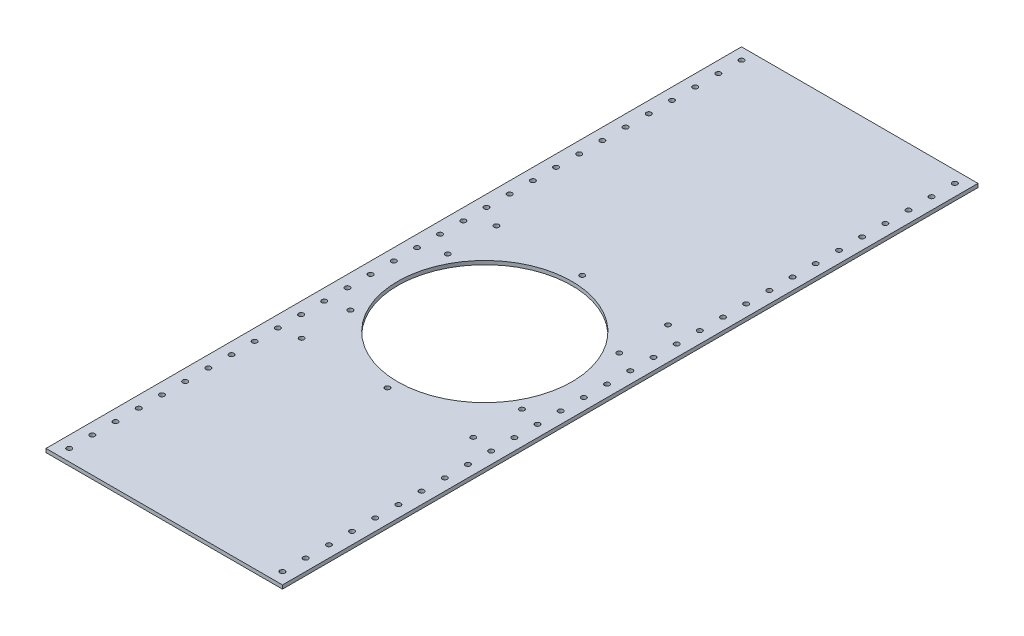
from build123d import *

# Parameters (mm, degrees)
SKETCH1_W           = 204
SKETCH1_H           = 600
SKETCH1_R           = 2.15
SKETCH1_R_2         = 2.125
SKETCH1_R_3         = 75.125
BOSS_EXTRUDE1_DEPTH = 3.175


with BuildPart() as part:
    # Sketch1 → Boss-Extrude1 (new body)
    with BuildSketch(Plane(origin=(0, 0, 0), x_dir=(1, 0, 0), z_dir=(0, 1, 0))):
        with Locations((0, -50)):
            Rectangle(SKETCH1_W, SKETCH1_H)
        with Locations((92, 240)):
            Circle(SKETCH1_R, mode=Mode.SUBTRACT)
        with Locations((92, 220)):
            Circle(SKETCH1_R, mode=Mode.SUBTRACT)
        with Locations((92, 200)):
            Circle(SKETCH1_R, mode=Mode.SUBTRACT)
        with Locations((92, 180)):
            Circle(SKETCH1_R, mode=Mode.SUBTRACT)
        with Locations((92, 160)):
            Circle(SKETCH1_R, mode=Mode.SUBTRACT)
        with Locations((92, 140)):
            Circle(SKETCH1_R, mode=Mode.SUBTRACT)
        with Locations((92, 120)):
            Circle(SKETCH1_R, mode=Mode.SUBTRACT)
        with Locations((92, 100)):
            Circle(SKETCH1_R, mode=Mode.SUBTRACT)
        with Locations((92, 80)):
            Circle(SKETCH1_R, mode=Mode.SUBTRACT)
        with Locations((92, 60)):
            Circle(SKETCH1_R, mode=Mode.SUBTRACT)
        with Locations((92, 40)):
            Circle(SKETCH1_R, mode=Mode.SUBTRACT)
        with Locations((92, 20)):
            Circle(SKETCH1_R, mode=Mode.SUBTRACT)
        with Locations((92, 0)):
            Circle(SKETCH1_R, mode=Mode.SUBTRACT)
        with Locations((92, -20)):
            Circle(SKETCH1_R, mode=Mode.SUBTRACT)
        with Locations((92, -40)):
            Circle(SKETCH1_R, mode=Mode.SUBTRACT)
        with Locations((92, -60)):
            Circle(SKETCH1_R, mode=Mode.SUBTRACT)
        with Locations((92, -80)):
            Circle(SKETCH1_R, mode=Mode.SUBTRACT)
        with Locations((92, -100)):
            Circle(SKETCH1_R, mode=Mode.SUBTRACT)
        with Locations((92, -120)):
            Circle(SKETCH1_R, mode=Mode.SUBTRACT)
        with Locations((92, -140)):
            Circle(SKETCH1_R, mode=Mode.SUBTRACT)
        with Locations((92, -160)):
            Circle(SKETCH1_R, mode=Mode.SUBTRACT)
        with Locations((92, -180)):
            Circle(SKETCH1_R, mode=Mode.SUBTRACT)
        with Locations((92, -200)):
            Circle(SKETCH1_R, mode=Mode.SUBTRACT)
        with Locations((92, -220)):
            Circle(SKETCH1_R, mode=Mode.SUBTRACT)
        with Locations((92, -240)):
            Circle(SKETCH1_R, mode=Mode.SUBTRACT)
        with Locations((92, -260)):
            Circle(SKETCH1_R, mode=Mode.SUBTRACT)
        with Locations((92, -280)):
            Circle(SKETCH1_R, mode=Mode.SUBTRACT)
        with Locations((92, -300)):
            Circle(SKETCH1_R, mode=Mode.SUBTRACT)
        with Locations((92, -320)):
            Circle(SKETCH1_R, mode=Mode.SUBTRACT)
        with Locations((92, -340)):
            Circle(SKETCH1_R, mode=Mode.SUBTRACT)
        with Locations((-92, -340)):
            Circle(SKETCH1_R, mode=Mode.SUBTRACT)
        with Locations((-92, -320)):
            Circle(SKETCH1_R, mode=Mode.SUBTRACT)
        with Locations((-92, -300)):
            Circle(SKETCH1_R, mode=Mode.SUBTRACT)
        with Locations((-92, -280)):
            Circle(SKETCH1_R, mode=Mode.SUBTRACT)
        with Locations((-92, -260)):
            Circle(SKETCH1_R, mode=Mode.SUBTRACT)
        with Locations((-92, -240)):
            Circle(SKETCH1_R, mode=Mode.SUBTRACT)
        with Locations((-92, -220)):
            Circle(SKETCH1_R, mode=Mode.SUBTRACT)
        with Locations((-92, -200)):
            Circle(SKETCH1_R, mode=Mode.SUBTRACT)
        with Locations((-92, -180)):
            Circle(SKETCH1_R, mode=Mode.SUBTRACT)
        with Locations((-92, -160)):
            Circle(SKETCH1_R, mode=Mode.SUBTRACT)
        with Locations((-92, -140)):
            Circle(SKETCH1_R, mode=Mode.SUBTRACT)
        with Locations((-92, -120)):
            Circle(SKETCH1_R, mode=Mode.SUBTRACT)
        with Locations((-92, -100)):
            Circle(SKETCH1_R, mode=Mode.SUBTRACT)
        with Locations((-92, -80)):
            Circle(SKETCH1_R, mode=Mode.SUBTRACT)
        with Locations((-92, -60)):
            Circle(SKETCH1_R, mode=Mode.SUBTRACT)
        with Locations((-92, -40)):
            Circle(SKETCH1_R, mode=Mode.SUBTRACT)
        with Locations((-92, -20)):
            Circle(SKETCH1_R, mode=Mode.SUBTRACT)
        with Locations((-92, 0)):
            Circle(SKETCH1_R, mode=Mode.SUBTRACT)
        with Locations((-92, 20)):
            Circle(SKETCH1_R, mode=Mode.SUBTRACT)
        with Locations((-92, 40)):
            Circle(SKETCH1_R, mode=Mode.SUBTRACT)
        with Locations((-92, 60)):
            Circle(SKETCH1_R, mode=Mode.SUBTRACT)
        with Locations((-92, 80)):
            Circle(SKETCH1_R, mode=Mode.SUBTRACT)
        with Locations((-92, 100)):
            Circle(SKETCH1_R, mode=Mode.SUBTRACT)
        with Locations((-92, 120)):
            Circle(SKETCH1_R, mode=Mode.SUBTRACT)
        with Locations((-92, 140)):
            Circle(SKETCH1_R, mode=Mode.SUBTRACT)
        with Locations((-92, 160)):
            Circle(SKETCH1_R, mode=Mode.SUBTRACT)
        with Locations((-92, 180)):
            Circle(SKETCH1_R, mode=Mode.SUBTRACT)
        with Locations((-92, 200)):
            Circle(SKETCH1_R, mode=Mode.SUBTRACT)
        with Locations((-92, 220)):
            Circle(SKETCH1_R, mode=Mode.SUBTRACT)
        with Locations((-92, 240)):
            Circle(SKETCH1_R, mode=Mode.SUBTRACT)
        with Locations((-74, -157.451)):
            Circle(SKETCH1_R_2, mode=Mode.SUBTRACT)
        with Locations((-74, -115.451)):
            Circle(SKETCH1_R_2, mode=Mode.SUBTRACT)
        with Locations((0, -157.451)):
            Circle(SKETCH1_R_2, mode=Mode.SUBTRACT)
        with Locations((74, -157.451)):
            Circle(SKETCH1_R_2, mode=Mode.SUBTRACT)
        with Locations((74, -115.451)):
            Circle(SKETCH1_R_2, mode=Mode.SUBTRACT)
        with Locations((74, -31.451)):
            Circle(SKETCH1_R_2, mode=Mode.SUBTRACT)
        with Locations((74, 10.549)):
            Circle(SKETCH1_R_2, mode=Mode.SUBTRACT)
        with Locations((0, 10.549)):
            Circle(SKETCH1_R_2, mode=Mode.SUBTRACT)
        with Locations((-74, 10.549)):
            Circle(SKETCH1_R_2, mode=Mode.SUBTRACT)
        with Locations((-74, -31.451)):
            Circle(SKETCH1_R_2, mode=Mode.SUBTRACT)
        with Locations((0, -73.451)):
            Circle(SKETCH1_R_3, mode=Mode.SUBTRACT)
    extrude(amount=BOSS_EXTRUDE1_DEPTH)


solid = part.part
